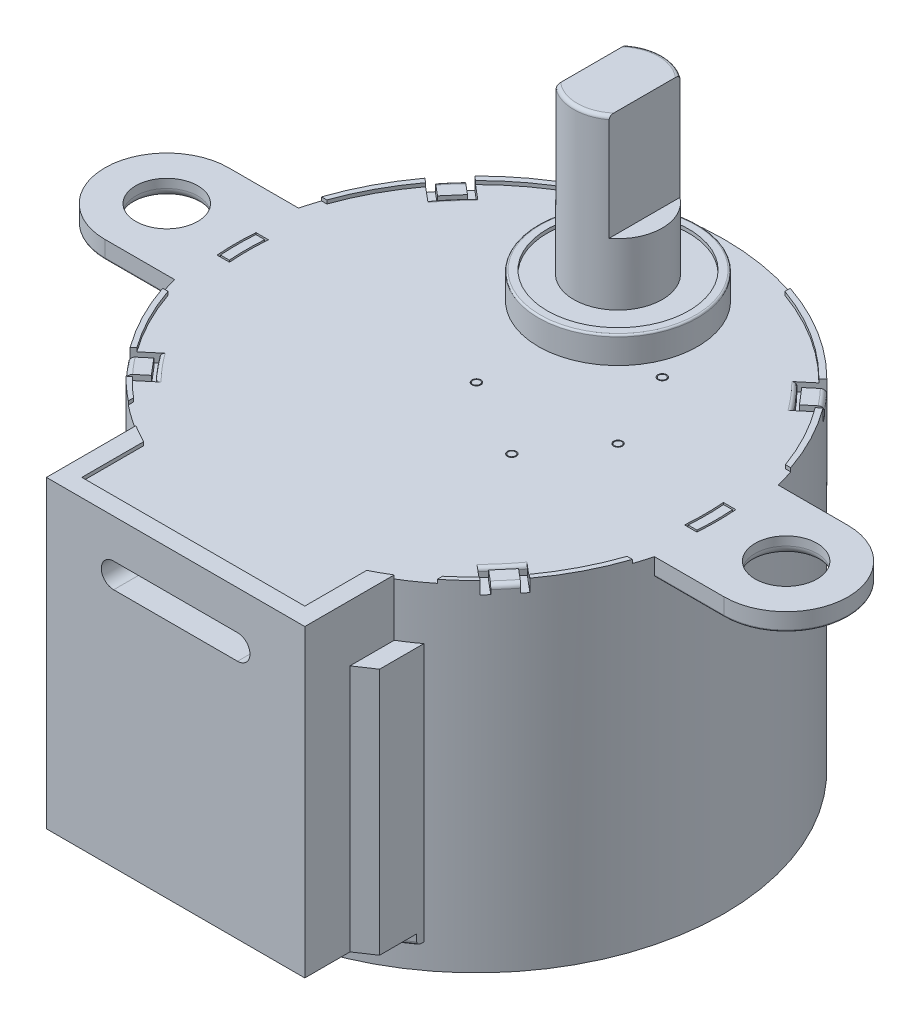
from build123d import *
from OCP.BRepFilletAPI import BRepFilletAPI_MakeFillet

# Parameters (mm, degrees)
BOSS_EXTRUDE1_DEPTH     = 17
SKETCH2_R               = 1.75
BOSS_EXTRUDE2_DEPTH     = 1
BOSS_EXTRUDE3_DEPTH     = 17
SKETCH4_R               = 14
BOSS_EXTRUDE4_DEPTH     = 2
BOSS_EXTRUDE6_DEPTH     = 14
BOSS_EXTRUDE6_2_DEPTH   = 14
CUT_EXTRUDE1_DEPTH      = 5
SKETCH8_R               = 4.5
BOSS_EXTRUDE7_DEPTH     = 1.5
SKETCH9_R               = 4
CUT_EXTRUDE2_DEPTH      = 0.2
SKETCH10_R              = 2.5
BOSS_EXTRUDE8_DEPTH     = 3.5
BOSS_EXTRUDE9_DEPTH     = 6
FILLET1_R               = 0.2
FILLET2_R               = 0.1
CUT_EXTRUDE3_DEPTH      = 1
SKETCH13_R              = 0.25
SKETCH13_R_2            = 0.2
CUT_EXTRUDE4_DEPTH      = 0.2
BOSS_EXTRUDE10_START    = 0.2
BOSS_EXTRUDE10_DEPTH    = 0.2
CUT_EXTRUDE5_DEPTH      = 0.2
CUT_EXTRUDE5_DEPTH_BACK = 0.5
FILLET7_R               = 0.2
BOSS_EXTRUDE11_START    = 0.2
BOSS_EXTRUDE11_DEPTH    = 0.2
CUT_EXTRUDE6_DEPTH      = 0.4
CIRPATTERN1_COUNT       = 8
FILLET8_R               = 0.4
FILLET11_R1             = 0.1
FILLET11_R2             = 0.5
SKETCH23_R              = 0.5
SKETCH23_R_2            = 0.85
CUT_EXTRUDE7_DEPTH      = 0.4
BOSS_EXTRUDE13_DEPTH    = 0.6
FILLET12_R              = 0.2
BOSS_EXTRUDE14_START    = 0.5
BOSS_EXTRUDE14_DEPTH    = 0.5
FILLET13_R              = 0.25


with BuildPart() as part:
    # Sketch1 → Boss-Extrude1 (new body)
    with BuildSketch(Plane(origin=(0, 0, 0), x_dir=(1, 0, 0), z_dir=(0, 1, 0))):
        with BuildLine():
            Line((-6.3, -16), (6.3, -16))
            Line((6.3, -16), (6.3, -12.50239977))
            ThreePointArc((6.3, -12.50239977), (0, 14), (-6.3, -12.50239977))
            Line((-6.3, -12.50239977), (-6.3, -16))
        make_face()
    extrude(amount=-BOSS_EXTRUDE1_DEPTH)

    # Sketch2 → Boss-Extrude2 (add)
    # profile 1 of 2: a face of its own
    with BuildSketch(Plane(origin=(0, 0, 0), x_dir=(1, 0, 0), z_dir=(0, 1, 0))):
        with BuildLine():
            Line((13.555441712, 3.5), (17.5, 3.5))
            ThreePointArc((17.5, 3.5), (21, 0), (17.5, -3.5))
            Line((17.5, -3.5), (13.555441712, -3.5))
            ThreePointArc((13.555441712, -3.5), (14, 0), (13.555441712, 3.5))
        make_face()
        with Locations(Location((17.5, 0, 0), (0, 0, 270))):
            Circle(SKETCH2_R, mode=Mode.SUBTRACT)
    # profile 2 of 2: a face of its own
    with BuildSketch(Plane(origin=(0, 0, 0), x_dir=(1, 0, 0), z_dir=(0, 1, 0))):
        with BuildLine():
            Line((-13.555441712, 3.5), (-17.5, 3.5))
            ThreePointArc((-17.5, 3.5), (-21, 0), (-17.5, -3.5))
            Line((-17.5, -3.5), (-13.555441712, -3.5))
            ThreePointArc((-13.555441712, -3.5), (-14, 0), (-13.555441712, 3.5))
        make_face()
        with Locations(Location((-17.5, 0, 0), (0, 0, 90))):
            Circle(SKETCH2_R, mode=Mode.SUBTRACT)
    extrude(amount=-BOSS_EXTRUDE2_DEPTH)


with BuildPart() as body_2:
    # Sketch3 → Boss-Extrude3 (new body)
    with BuildSketch(Plane(origin=(0, 0, 0), x_dir=(1, 0, 0), z_dir=(0, 1, 0))):
        with BuildLine():
            Line((-6.3, -12.50239977), (-6.3, -16))
            Line((-6.3, -16), (6.3, -16))
            Line((6.3, -16), (6.3, -12.50239977))
            ThreePointArc((6.3, -12.50239977), (6.805685805, -12.234485716), (7.300000001, -11.946129081))
            Line((7.300000001, -11.946129081), (7.300000001, -17))
            Line((7.300000001, -17), (-7.299999999, -17))
            Line((-7.299999999, -17), (-7.299999999, -11.946129081))
            ThreePointArc((-7.299999999, -11.946129081), (-6.805685804, -12.234485716), (-6.3, -12.50239977))
        make_face()
    extrude(amount=-BOSS_EXTRUDE3_DEPTH)


with BuildPart() as body_3:
    # Sketch4 → Boss-Extrude4 (new body)
    with BuildSketch(Plane.XZ.offset(17)):
        with Locations(Location((0, 0, 0), (0, 0, 270))):
            Circle(SKETCH4_R)
    extrude(amount=BOSS_EXTRUDE4_DEPTH)

    # Sketch21 → Cut-Extrude6 (cut)
    with BuildSketch(Plane.XZ.offset(19)):
        with BuildLine():
            Line((-1.25, 6.887488657), (-0.6, 10.387488657))
            Line((-0.6, 10.387488657), (0.6, 10.387488657))
            Line((0.6, 10.387488657), (1.25, 6.887488657))
            ThreePointArc((1.25, 6.887488657), (0, 7), (-1.25, 6.887488657))
        make_face()
    cut_extrude6 = extrude(amount=-CUT_EXTRUDE6_DEPTH, mode=Mode.SUBTRACT)

    # CirPattern1: Cut-Extrude6 ×8 about axis
    cirpattern1_axis = Axis((0, 0, 0), (0, 1, 0))
    for i in range(1, CIRPATTERN1_COUNT):
        add(cut_extrude6.rotate(cirpattern1_axis, i * 360 / CIRPATTERN1_COUNT), mode=Mode.SUBTRACT)

    # Fillet8
    # the kernel refuses this fillet: 0.4 mm, written as the material it takes off along each edge
    with BuildSketch(Plane(origin=(0, -19, 0), x_dir=(0.4466375474291831, 0, -0.8947149832356918), z_dir=(-0.8947149832356918, 0, -0.4466375474291831))) as fillet8_piece_1_section:
        with BuildLine():
            CenterArc((7 - FILLET8_R, -FILLET8_R), FILLET8_R, 0, 90)
            Line((7, -FILLET8_R), (7, 0))
            Line((7, 0), (7 - FILLET8_R, 0))
        make_face()
    fillet8_piece_1 = revolve(axis=Axis((0, -19, 0), (0, -1, 0)), revolution_arc=36.943687471, mode=Mode.PRIVATE)
    fillet8_piece_1 = split(fillet8_piece_1, bisect_by=Plane(origin=(4.159527105, -18.910136178, -5.873032168), z_dir=(0.5661072440079581, 0, 0.8243316009238724)), keep=Keep.TOP, mode=Mode.PRIVATE)
    fillet8_piece_1 = split(fillet8_piece_1, bisect_by=Plane(origin=(5.873032411, -18.910136178, -4.159527458), z_dir=(-0.8243316009238723, 0, -0.5661072440079582)), keep=Keep.TOP, mode=Mode.PRIVATE)
    add(fillet8_piece_1, mode=Mode.SUBTRACT)
    with BuildSketch(Plane(origin=(0, -19, 0), x_dir=(-0.3168385933554622, 0, -0.9484794703948696), z_dir=(-0.9484794703948696, 0, 0.3168385933554622))) as fillet8_piece_2_section:
        with BuildLine():
            CenterArc((7 - FILLET8_R, -FILLET8_R), FILLET8_R, 0, 90)
            Line((7, -FILLET8_R), (7, 0))
            Line((7, 0), (7 - FILLET8_R, 0))
        make_face()
    fillet8_piece_2 = revolve(axis=Axis((0, -19, 0), (0, -1, 0)), revolution_arc=36.943687471, mode=Mode.PRIVATE)
    fillet8_piece_2 = split(fillet8_piece_2, bisect_by=Plane(origin=(-1.21163105, -18.910136178, -7.094090694), z_dir=(0.9831887360764877, 0, 0.18259219384277842)), keep=Keep.TOP, mode=Mode.PRIVATE)
    fillet8_piece_2 = split(fillet8_piece_2, bisect_by=Plane(origin=(1.211630972, -18.910136178, -7.094091117), z_dir=(-0.9831887360764877, 0, 0.1825921938427782)), keep=Keep.TOP, mode=Mode.PRIVATE)
    add(fillet8_piece_2, mode=Mode.SUBTRACT)
    with BuildSketch(Plane(origin=(0, -19, 0), x_dir=(-0.8947149832356917, 0, -0.44663754742918316), z_dir=(-0.44663754742918316, 0, 0.8947149832356917))) as fillet8_piece_3_section:
        with BuildLine():
            CenterArc((7 - FILLET8_R, -FILLET8_R), FILLET8_R, 0, 90)
            Line((7, -FILLET8_R), (7, 0))
            Line((7, 0), (7 - FILLET8_R, 0))
        make_face()
    fillet8_piece_3 = revolve(axis=Axis((0, -19, 0), (0, -1, 0)), revolution_arc=36.943687471, mode=Mode.PRIVATE)
    fillet8_piece_3 = split(fillet8_piece_3, bisect_by=Plane(origin=(-5.873032168, -18.910136178, -4.159527105), z_dir=(0.8243316009238725, 0, -0.566107244007958)), keep=Keep.TOP, mode=Mode.PRIVATE)
    fillet8_piece_3 = split(fillet8_piece_3, bisect_by=Plane(origin=(-4.159527458, -18.910136178, -5.873032411), z_dir=(-0.5661072440079583, 0, 0.8243316009238724)), keep=Keep.TOP, mode=Mode.PRIVATE)
    add(fillet8_piece_3, mode=Mode.SUBTRACT)
    with BuildSketch(Plane(origin=(0, -19, 0), x_dir=(-0.9484794703948696, 0, 0.3168385933554621), z_dir=(0.3168385933554621, 0, 0.9484794703948696))) as fillet8_piece_4_section:
        with BuildLine():
            CenterArc((7 - FILLET8_R, -FILLET8_R), FILLET8_R, 0, 90)
            Line((7, -FILLET8_R), (7, 0))
            Line((7, 0), (7 - FILLET8_R, 0))
        make_face()
    fillet8_piece_4 = revolve(axis=Axis((0, -19, 0), (0, -1, 0)), revolution_arc=36.943687471, mode=Mode.PRIVATE)
    fillet8_piece_4 = split(fillet8_piece_4, bisect_by=Plane(origin=(-7.094090694, -18.910136178, 1.21163105), z_dir=(0.18259219384277853, 0, -0.9831887360764877)), keep=Keep.TOP, mode=Mode.PRIVATE)
    fillet8_piece_4 = split(fillet8_piece_4, bisect_by=Plane(origin=(-7.094091117, -18.910136178, -1.211630972), z_dir=(0.18259219384277808, 0, 0.9831887360764877)), keep=Keep.TOP, mode=Mode.PRIVATE)
    add(fillet8_piece_4, mode=Mode.SUBTRACT)
    with BuildSketch(Plane(origin=(0, -19, 0), x_dir=(-0.4466375474291833, 0, 0.8947149832356917), z_dir=(0.8947149832356917, 0, 0.4466375474291833))) as fillet8_piece_5_section:
        with BuildLine():
            CenterArc((7 - FILLET8_R, -FILLET8_R), FILLET8_R, 0, 90)
            Line((7, -FILLET8_R), (7, 0))
            Line((7, 0), (7 - FILLET8_R, 0))
        make_face()
    fillet8_piece_5 = revolve(axis=Axis((0, -19, 0), (0, -1, 0)), revolution_arc=36.943687471, mode=Mode.PRIVATE)
    fillet8_piece_5 = split(fillet8_piece_5, bisect_by=Plane(origin=(-4.159527105, -18.910136178, 5.873032168), z_dir=(-0.566107244007958, 0, -0.8243316009238725)), keep=Keep.TOP, mode=Mode.PRIVATE)
    fillet8_piece_5 = split(fillet8_piece_5, bisect_by=Plane(origin=(-5.873032411, -18.910136178, 4.159527458), z_dir=(0.8243316009238721, 0, 0.5661072440079583)), keep=Keep.TOP, mode=Mode.PRIVATE)
    add(fillet8_piece_5, mode=Mode.SUBTRACT)
    with BuildSketch(Plane(origin=(0, -19, 0), x_dir=(0.3168385933554623, 0, 0.9484794703948695), z_dir=(0.9484794703948695, 0, -0.3168385933554623))) as fillet8_piece_6_section:
        with BuildLine():
            CenterArc((7 - FILLET8_R, -FILLET8_R), FILLET8_R, 0, 90)
            Line((7, -FILLET8_R), (7, 0))
            Line((7, 0), (7 - FILLET8_R, 0))
        make_face()
    fillet8_piece_6 = revolve(axis=Axis((0, -19, 0), (0, -1, 0)), revolution_arc=36.943687471, mode=Mode.PRIVATE)
    fillet8_piece_6 = split(fillet8_piece_6, bisect_by=Plane(origin=(1.21163105, -18.910136178, 7.094090694), z_dir=(-0.9831887360764877, 0, -0.1825921938427783)), keep=Keep.TOP, mode=Mode.PRIVATE)
    fillet8_piece_6 = split(fillet8_piece_6, bisect_by=Plane(origin=(-1.211630972, -18.910136178, 7.094091117), z_dir=(0.9831887360764877, 0, -0.1825921938427783)), keep=Keep.TOP, mode=Mode.PRIVATE)
    add(fillet8_piece_6, mode=Mode.SUBTRACT)
    with BuildSketch(Plane(origin=(0, -19, 0), x_dir=(0.8947149832356918, 0, 0.4466375474291831), z_dir=(0.4466375474291831, 0, -0.8947149832356918))) as fillet8_piece_7_section:
        with BuildLine():
            CenterArc((7 - FILLET8_R, -FILLET8_R), FILLET8_R, 0, 90)
            Line((7, -FILLET8_R), (7, 0))
            Line((7, 0), (7 - FILLET8_R, 0))
        make_face()
    fillet8_piece_7 = revolve(axis=Axis((0, -19, 0), (0, -1, 0)), revolution_arc=36.943687471, mode=Mode.PRIVATE)
    fillet8_piece_7 = split(fillet8_piece_7, bisect_by=Plane(origin=(5.873032168, -18.910136178, 4.159527105), z_dir=(-0.8243316009238724, 0, 0.5661072440079581)), keep=Keep.TOP, mode=Mode.PRIVATE)
    fillet8_piece_7 = split(fillet8_piece_7, bisect_by=Plane(origin=(4.159527458, -18.910136178, 5.873032411), z_dir=(0.5661072440079582, 0, -0.8243316009238723)), keep=Keep.TOP, mode=Mode.PRIVATE)
    add(fillet8_piece_7, mode=Mode.SUBTRACT)
    with BuildSketch(Plane(origin=(0, -19, 0), x_dir=(0.9484794703948695, 0, -0.31683859335546216), z_dir=(-0.31683859335546216, 0, -0.9484794703948695))) as fillet8_piece_8_section:
        with BuildLine():
            CenterArc((7 - FILLET8_R, -FILLET8_R), FILLET8_R, 0, 90)
            Line((7, -FILLET8_R), (7, 0))
            Line((7, 0), (7 - FILLET8_R, 0))
        make_face()
    fillet8_piece_8 = revolve(axis=Axis((0, -19, 0), (0, -1, 0)), revolution_arc=36.943687471, mode=Mode.PRIVATE)
    fillet8_piece_8 = split(fillet8_piece_8, bisect_by=Plane(origin=(7.094090694, -18.910136178, -1.21163105), z_dir=(-0.18259219384277842, 0, 0.9831887360764877)), keep=Keep.TOP, mode=Mode.PRIVATE)
    fillet8_piece_8 = split(fillet8_piece_8, bisect_by=Plane(origin=(7.094091117, -18.910136178, 1.211630972), z_dir=(-0.1825921938427782, 0, -0.9831887360764877)), keep=Keep.TOP, mode=Mode.PRIVATE)
    add(fillet8_piece_8, mode=Mode.SUBTRACT)

    # Sketch23 → Cut-Extrude7 (cut)
    with BuildSketch(Plane.XZ.offset(19)):
        with Locations(Location((0, 0, 0), (0, 0, 270))):
            Circle(SKETCH23_R)
        with Locations(Location((9.205048535, -3.907311285, 0), (0, 0, 270))):
            Circle(SKETCH23_R_2)
        with Locations(Location((-9.205048535, 3.907311285, 0), (0, 0, 270))):
            Circle(SKETCH23_R_2)
    extrude(amount=-CUT_EXTRUDE7_DEPTH, mode=Mode.SUBTRACT)


with BuildPart() as body_4:
    # Sketch6 → Boss-Extrude6 (new body)
    with BuildSketch(Plane.XZ.offset(17)):
        with BuildLine():
            Line((7.300000001, 14.44612908), (8.300000001, 13.774307074))
            Line((8.300000001, 13.774307074), (8.300000001, 11.274307074))
            ThreePointArc((8.300000001, 11.274307074), (7.80722974, 11.620979468), (7.300000001, 11.94612908))
            Line((7.300000001, 11.94612908), (7.300000001, 14.44612908))
        make_face()
    extrude(amount=-BOSS_EXTRUDE6_DEPTH)


with BuildPart() as body_5:
    # Sketch6 → Boss-Extrude6 2 (new body)
    with BuildSketch(Plane.XZ.offset(17)):
        with BuildLine():
            Line((-7.300000001, 14.44612908), (-7.300000001, 11.94612908))
            ThreePointArc((-7.300000001, 11.94612908), (-7.80722974, 11.620979468), (-8.300000001, 11.274307074))
            Line((-8.300000001, 11.274307074), (-8.300000001, 13.774307074))
            Line((-8.300000001, 13.774307074), (-7.300000001, 14.44612908))
        make_face()
    extrude(amount=-BOSS_EXTRUDE6_2_DEPTH)


with BuildPart() as cut_extrude1_tool:
    # Sketch7 → Cut-Extrude1 (new body)
    with BuildSketch(Plane.XY.offset(17)):
        with BuildLine():
            Line((-3.5, -2), (3.5, -2))
            ThreePointArc((3.5, -2), (4.2, -2.7), (3.5, -3.4))
            Line((3.5, -3.4), (-3.5, -3.4))
            ThreePointArc((-3.5, -3.4), (-4.2, -2.7), (-3.5, -2))
        make_face()
    extrude(amount=-CUT_EXTRUDE1_DEPTH)


with BuildPart() as part_1:
    add(part.part)

    # Cut-Extrude1: cut by cut_extrude1_tool
    add(cut_extrude1_tool.part, mode=Mode.SUBTRACT)

    # Sketch8 → Boss-Extrude7 (add)
    with BuildSketch(Plane(origin=(0, 0, 0), x_dir=(1, 0, 0), z_dir=(0, 1, 0))):
        with Locations(Location((0, 8, 0), (0, 0, 270))):
            Circle(SKETCH8_R)
    extrude(amount=BOSS_EXTRUDE7_DEPTH)

    # Sketch9 → Cut-Extrude2 (cut)
    with BuildSketch(Plane(origin=(0, 1.5, 0), x_dir=(1, 0, 0), z_dir=(0, 1, 0))):
        with Locations(Location((0, 8, 0), (0, 0, 270))):
            Circle(SKETCH9_R)
    extrude(amount=-CUT_EXTRUDE2_DEPTH, mode=Mode.SUBTRACT)

    # Sketch10 → Boss-Extrude8 (add)
    with BuildSketch(Plane(origin=(0, 1.3, 0), x_dir=(1, 0, 0), z_dir=(0, 1, 0))):
        with Locations(Location((0, 8, 0), (0, 0, 270))):
            Circle(SKETCH10_R)
    extrude(amount=BOSS_EXTRUDE8_DEPTH)

    # Sketch11 → Boss-Extrude9 (add)
    with BuildSketch(Plane(origin=(0, 4.8, 0), x_dir=(1, 0, 0), z_dir=(0, 1, 0))):
        with BuildLine():
            Line((-1.5, 10), (-1.5, 6))
            ThreePointArc((-1.5, 6), (0, 5.5), (1.5, 6))
            Line((1.5, 6), (1.5, 10))
            ThreePointArc((1.5, 10), (0, 10.5), (-1.5, 10))
        make_face()
    extrude(amount=BOSS_EXTRUDE9_DEPTH)

    # Fillet1
    fillet1_edges = [part_1.edges().sort_by_distance(p)[0] for p in [
        (0, 10.8, -10.5),
        (0, 10.8, -5.5),
    ]]
    fillet(fillet1_edges, radius=FILLET1_R)

    # Fillet2
    fillet2_edges = [part_1.edges().sort_by_distance(p)[0] for p in [
        (0, 1.5, -12.5),
    ]]
    fillet(fillet2_edges, radius=FILLET2_R)

    # Sketch12 → Cut-Extrude3 (cut)
    # profile 1 of 2: a face of its own
    with BuildSketch(Plane(origin=(0, 0, 0), x_dir=(1, 0, 0), z_dir=(0, 1, 0))):
        with BuildLine():
            Line((-12.856406461, -1.1), (-13.557026713, -1.1))
            ThreePointArc((-13.557026713, -1.1), (-13.6, 0), (-13.557026713, 1.1))
            Line((-13.557026713, 1.1), (-12.856406461, 1.1))
            ThreePointArc((-12.856406461, 1.1), (-12.9, 0), (-12.856406461, -1.1))
        make_face()
        with BuildLine():
            Line((-12.964240044, 1), (-13.464240044, 1))
            ThreePointArc((-13.464240044, 1), (-13.5, 0), (-13.464240044, -1))
            Line((-13.464240044, -1), (-12.964240044, -1))
            ThreePointArc((-12.964240044, -1), (-13, 0), (-12.964240044, 1))
        make_face(mode=Mode.SUBTRACT)
    # profile 2 of 2: a face of its own
    with BuildSketch(Plane(origin=(0, 0, 0), x_dir=(1, 0, 0), z_dir=(0, 1, 0))):
        with BuildLine():
            Line((12.856406461, 1.1), (13.557026713, 1.1))
            ThreePointArc((13.557026713, 1.1), (13.6, 0), (13.557026713, -1.1))
            Line((13.557026713, -1.1), (12.856406461, -1.1))
            ThreePointArc((12.856406461, -1.1), (12.9, 0), (12.856406461, 1.1))
        make_face()
        with BuildLine():
            Line((12.964240044, -1), (13.464240044, -1))
            ThreePointArc((13.464240044, -1), (13.5, 0), (13.464240044, 1))
            Line((13.464240044, 1), (12.964240044, 1))
            ThreePointArc((12.964240044, 1), (13, 0), (12.964240044, -1))
        make_face(mode=Mode.SUBTRACT)
    extrude(amount=-CUT_EXTRUDE3_DEPTH, mode=Mode.SUBTRACT)

    # Sketch13 → Cut-Extrude4 (cut)
    # profile 1 of 4: a face of its own
    with BuildSketch(Plane(origin=(0, 0, 0), x_dir=(1, 0, 0), z_dir=(0, 1, 0))):
        with Locations(Location((0, 0, 0), (0, 0, 270))):
            Circle(SKETCH13_R)
        with Locations(Location((0, 0, 0), (0, 0, 270))):
            Circle(SKETCH13_R_2, mode=Mode.SUBTRACT)
    # profile 2 of 4: a face of its own
    with BuildSketch(Plane(origin=(0, 0, 0), x_dir=(1, 0, 0), z_dir=(0, 1, 0))):
        with Locations(Location((5, 5.5, 0), (0, 0, 270))):
            Circle(SKETCH13_R)
        with Locations(Location((5, 5.5, 0), (0, 0, 270))):
            Circle(SKETCH13_R_2, mode=Mode.SUBTRACT)
    # profile 3 of 4: a face of its own
    with BuildSketch(Plane(origin=(0, 0, 0), x_dir=(1, 0, 0), z_dir=(0, 1, 0))):
        with Locations(Location((4.5, -2.5, 0), (0, 0, 270))):
            Circle(SKETCH13_R)
        with Locations(Location((4.5, -2.5, 0), (0, 0, 270))):
            Circle(SKETCH13_R_2, mode=Mode.SUBTRACT)
    # profile 4 of 4: a face of its own
    with BuildSketch(Plane(origin=(0, 0, 0), x_dir=(1, 0, 0), z_dir=(0, 1, 0))):
        with Locations(Location((7, 1, 0), (0, 0, 270))):
            Circle(SKETCH13_R)
        with Locations(Location((7, 1, 0), (0, 0, 270))):
            Circle(SKETCH13_R_2, mode=Mode.SUBTRACT)
    extrude(amount=-CUT_EXTRUDE4_DEPTH, mode=Mode.SUBTRACT)

    # Sketch15 → Boss-Extrude10 (add)
    with BuildSketch(Plane(origin=(0, 0, 0), x_dir=(1, 0, 0), z_dir=(0, 1, 0)).offset(BOSS_EXTRUDE10_START)):
        with BuildLine():
            Line((-4.457842663, 12.971308858), (-4.457842663, 13.271308858))
            ThreePointArc((-4.457842663, 13.271308858), (-9.883750764, 9.915214109), (-13.257073584, 4.5))
            Line((-13.257073584, 4.5), (-12.957073584, 4.5))
            ThreePointArc((-12.957073584, 4.5), (-9.661108206, 9.692447813), (-4.457842663, 12.971308858))
        make_face()
        with BuildLine():
            Line((-12.971020993, -4.458699564), (-13.271020993, -4.458699564))
            ThreePointArc((-13.271020993, -4.458699564), (-11.468646589, -8.029330322), (-8.730175651, -10.944589216))
            Line((-8.730175651, -10.944589216), (-8.730175651, -10.644589216))
            ThreePointArc((-8.730175651, -10.644589216), (-11.272541187, -7.840914735), (-12.971020993, -4.458699564))
        make_face()
        with BuildLine():
            Line((8.730175651, -10.944589216), (8.730175651, -10.644589216))
            ThreePointArc((8.730175651, -10.644589216), (11.272541187, -7.840914735), (12.971020993, -4.458699564))
            Line((12.971020993, -4.458699564), (13.271020993, -4.458699564))
            ThreePointArc((13.271020993, -4.458699564), (11.468646589, -8.029330322), (8.730175651, -10.944589216))
        make_face()
        with BuildLine():
            Line((12.957073584, 4.5), (13.257073584, 4.5))
            ThreePointArc((13.257073584, 4.5), (9.883750764, 9.915214109), (4.457842663, 13.271308858))
            Line((4.457842663, 13.271308858), (4.457842663, 12.971308858))
            ThreePointArc((4.457842663, 12.971308858), (9.661108206, 9.692447813), (12.957073584, 4.5))
        make_face()
    extrude(amount=-BOSS_EXTRUDE10_DEPTH)

    # Sketch17 → Cut-Extrude5 (cut, two sides: drawn at the far end of the back side and taken through both)
    with BuildSketch(Plane(origin=(0, 0, 0), x_dir=(1, 0, 0), z_dir=(0, 1, 0)).offset(-CUT_EXTRUDE5_DEPTH_BACK)):
        with BuildLine():
            Line((-11.248150928, 8.335412449), (-10.328897597, 7.564067317))
            ThreePointArc((-10.328897597, 7.564067317), (-9.704780037, 8.34621567), (-9.026388911, 9.08178637))
            Line((-9.026388911, 9.08178637), (-9.945642242, 9.853131501))
            ThreePointArc((-9.945642242, 9.853131501), (-10.624033369, 9.117560802), (-11.248150928, 8.335412449))
        make_face()
        with BuildLine():
            Line((-10.374845454, -7.501703437), (-11.294098786, -8.273048569))
            ThreePointArc((-11.294098786, -8.273048569), (-10.674318425, -9.058638207), (-10.000007613, -9.797951201))
            Line((-10.000007613, -9.797951201), (-9.080754281, -9.026606069))
            ThreePointArc((-9.080754281, -9.026606069), (-9.755065093, -8.287293075), (-10.374845454, -7.501703437))
        make_face()
        with BuildLine():
            Line((9.080754281, -9.026606069), (10.000007613, -9.797951201))
            ThreePointArc((10.000007613, -9.797951201), (10.674318425, -9.058638207), (11.294098786, -8.273048569))
            Line((11.294098786, -8.273048569), (10.374845454, -7.501703437))
            ThreePointArc((10.374845454, -7.501703437), (9.755065093, -8.287293075), (9.080754281, -9.026606069))
        make_face()
        with BuildLine():
            Line((9.026388911, 9.08178637), (9.945642242, 9.853131501))
            ThreePointArc((9.945642242, 9.853131501), (10.624033369, 9.117560802), (11.248150928, 8.335412449))
            Line((11.248150928, 8.335412449), (10.328897597, 7.564067317))
            ThreePointArc((10.328897597, 7.564067317), (9.704780037, 8.34621567), (9.026388911, 9.08178637))
        make_face()
    extrude(amount=CUT_EXTRUDE5_DEPTH + CUT_EXTRUDE5_DEPTH_BACK, mode=Mode.SUBTRACT)

    # Fillet7
    fillet7_edges = [part_1.edges().sort_by_distance(p)[0] for p in [
        (-9.704780037, 0, -8.34621567),
        (-9.755065093, 0, 8.287293075),
        (9.755065093, 0, 8.287293075),
        (9.704780037, 0, -8.34621567),
    ]]
    fillet(fillet7_edges, radius=FILLET7_R)



with BuildPart() as body_2_1:
    add(body_2.part)

    # Cut-Extrude1: cut by cut_extrude1_tool
    add(cut_extrude1_tool.part, mode=Mode.SUBTRACT)


with BuildPart() as part_2:
    add(part_1.part)

    add(body_2_1.part)  # Boss-Extrude11 merges body 2
    # Sketch19 → Boss-Extrude11 (add)
    with BuildSketch(Plane(origin=(0, 0, 0), x_dir=(1, 0, 0), z_dir=(0, 1, 0)).offset(BOSS_EXTRUDE11_START)):
        with BuildLine():
            Line((-7.299999999, -11.946129081), (-7.299999999, -17))
            Line((-7.299999999, -17), (7.300000001, -17))
            Line((7.300000001, -17), (7.300000001, -11.94612908))
            ThreePointArc((7.300000001, -11.94612908), (6.805685805, -12.234485716), (6.3, -12.50239977))
            Line((6.3, -12.50239977), (6.3, -16))
            Line((6.3, -16), (-6.3, -16))
            Line((-6.3, -16), (-6.3, -12.50239977))
            ThreePointArc((-6.3, -12.50239977), (-6.805685804, -12.234485716), (-7.299999999, -11.946129081))
        make_face()
    extrude(amount=-BOSS_EXTRUDE11_DEPTH)

    # Fillet11: one fillet with a radius per group of edges: ONE call of the kernel's fillet builder (fillet() takes one radius for all edges)
    fillet11_edges_1 = [part_2.edges().sort_by_distance(p)[0] for p in [
        (-15.527720856, -1, -3.5),
        (-21, -1, 0),
        (-15.527720856, -1, 3.5),
        (15.527720856, -1, 3.5),
        (21, -1, 0),
        (15.527720856, -1, -3.5),
    ]]
    fillet11_edges_2 = [part_2.edges().sort_by_distance(p)[0] for p in [
        (17.5, -1, -1.75),
        (-17.5, -1, 1.75),
    ]]
    fillet11 = BRepFilletAPI_MakeFillet(part_2.part.solid().wrapped)
    for e in fillet11_edges_1:
        fillet11.Add(FILLET11_R1, e.wrapped)
    for e in fillet11_edges_2:
        fillet11.Add(FILLET11_R2, e.wrapped)
    add(Compound.cast(fillet11.Shape()), mode=Mode.REPLACE)


    add(body_3.part)  # Boss-Extrude13 merges body 3

    add(body_4.part)  # Boss-Extrude13 merges body 4

    add(body_5.part)  # Boss-Extrude13 merges body 5
    # Sketch25 → Boss-Extrude13 (add)
    with BuildSketch(Plane.XZ.offset(17)):
        with BuildLine():
            Line((8.300000001, 11.274307074), (8.300000001, 11.674307074))
            ThreePointArc((8.300000001, 11.674307074), (4.958079592, 13.492648577), (1.25, 14.344084767))
            Line((1.25, 14.344084767), (1.25, 13.944084767))
            ThreePointArc((1.25, 13.944084767), (4.958079592, 13.092648577), (8.300000001, 11.274307074))
        make_face()
        with BuildLine():
            Line((-1.25, 13.944084767), (-1.25, 14.344084767))
            ThreePointArc((-1.25, 14.344084767), (-4.958079592, 13.492648577), (-8.300000001, 11.674307074))
            Line((-8.300000001, 11.674307074), (-8.300000001, 11.274307074))
            ThreePointArc((-8.300000001, 11.274307074), (-4.958079592, 13.092648577), (-1.25, 13.944084767))
        make_face()
    extrude(amount=BOSS_EXTRUDE13_DEPTH)

    # Fillet12
    fillet12_edges = [part_2.edges().sort_by_distance(p)[0] for p in [
        (-4.958079592, -17.6, 13.492648577),
        (4.958079592, -17.6, 13.492648577),
    ]]
    fillet(fillet12_edges, radius=FILLET12_R)

    # Sketch27 → Boss-Extrude14 (add)
    with BuildSketch(Plane(origin=(0, -0.5, 0), x_dir=(1, 0, 0), z_dir=(0, 1, 0)).offset(BOSS_EXTRUDE14_START)):
        with BuildLine():
            Line((-11.070727348, -8.569655535), (-10.304682905, -7.926867925))
            Line((-10.304682905, -7.926867925), (-9.530147913, -8.843435187))
            Line((-9.530147913, -8.843435187), (-10.296192357, -9.486222797))
            ThreePointArc((-10.296192357, -9.486222797), (-10.693284729, -9.036241569), (-11.070727348, -8.569655535))
        make_face()
        with BuildLine():
            Line((-10.992787097, 8.669407814), (-10.226742654, 8.026620204))
            Line((-10.226742654, 8.026620204), (-9.443951634, 8.936146575))
            Line((-9.443951634, 8.936146575), (-10.209996077, 9.578934184))
            ThreePointArc((-10.209996077, 9.578934184), (-10.611140991, 9.1325619), (-10.992787097, 8.669407814))
        make_face()
        with BuildLine():
            Line((10.226742654, 8.026620204), (9.443951634, 8.936146575))
            Line((9.443951634, 8.936146575), (10.209996077, 9.578934184))
            ThreePointArc((10.209996077, 9.578934184), (10.611140991, 9.1325619), (10.992787097, 8.669407814))
            Line((10.992787097, 8.669407814), (10.226742654, 8.026620204))
        make_face()
        with BuildLine():
            Line((9.530147913, -8.843435187), (10.304682905, -7.926867925))
            Line((10.304682905, -7.926867925), (11.070727348, -8.569655535))
            ThreePointArc((11.070727348, -8.569655535), (10.693284729, -9.036241569), (10.296192357, -9.486222797))
            Line((10.296192357, -9.486222797), (9.530147913, -8.843435187))
        make_face()
    extrude(amount=-BOSS_EXTRUDE14_DEPTH)

    # Fillet13
    fillet13_edges = [part_2.edges().sort_by_distance(p)[0] for p in [
        (10.611140991, 0, -9.1325619),
        (10.693284729, 0, 9.036241569),
        (-10.693284729, 0, 9.036241569),
        (-10.611140991, 0, -9.1325619),
    ]]
    fillet(fillet13_edges, radius=FILLET13_R)


solid = part_2.part
